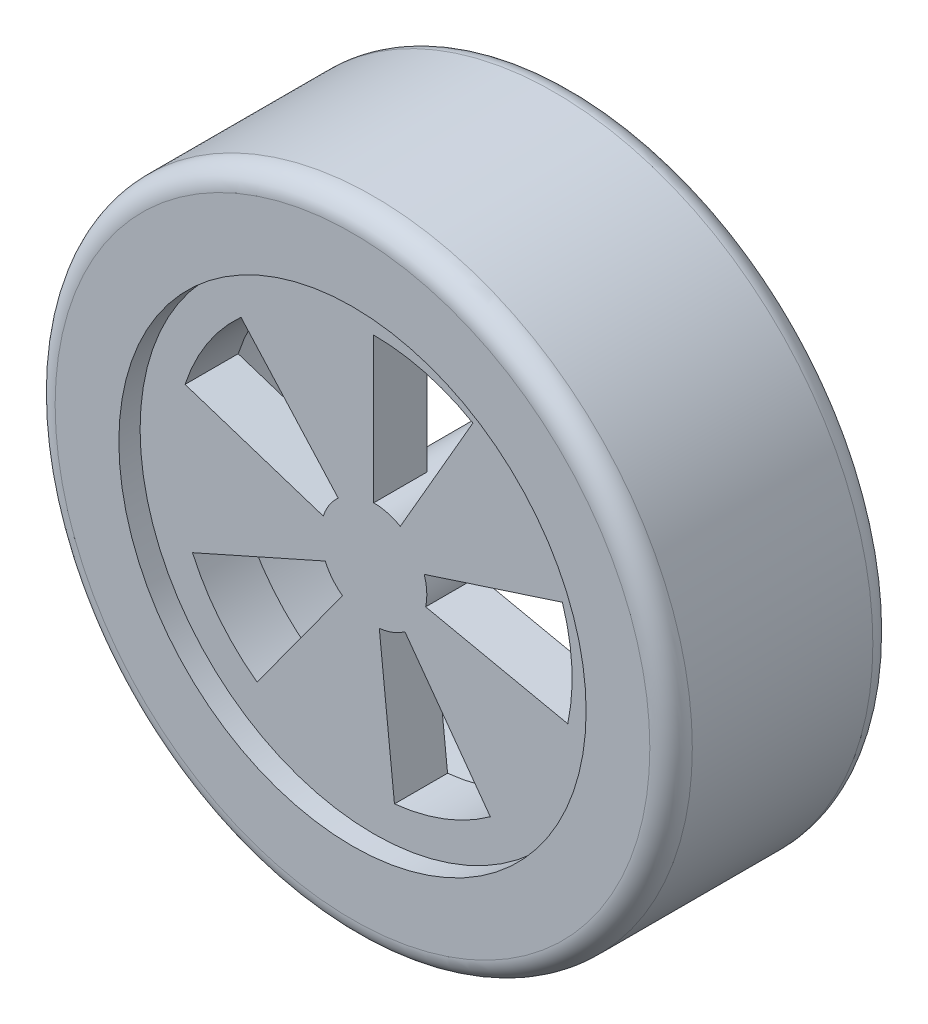
from build123d import *
from build123d.topology import SkipClean

# Parameters (mm, degrees)
SKETCH1_R           = 15
BOSS_EXTRUDE1_DEPTH = 10.5
SKETCH2_R           = 11
CUT_EXTRUDE1_DEPTH  = 1
SKETCH3_R           = 12
SKETCH3_R_2         = 2.5
SKETCH3_R_3         = 1
CUT_EXTRUDE2_DEPTH  = 7
BOSS_EXTRUDE2_START = 2.5
SKETCH3_4_R         = 2.5
SKETCH3_4_R_2       = 1
BOSS_EXTRUDE2_DEPTH = 2.5
FILLET1_R           = 1
CUT_EXTRUDE3_DEPTH  = 25.372115214


with BuildPart() as part:
    # Sketch1 → Boss-Extrude1 (new body)
    with BuildSketch(Plane.XY):
        Circle(SKETCH1_R)
    extrude(amount=BOSS_EXTRUDE1_DEPTH)

    # Sketch2 → Cut-Extrude1 (cut)
    with BuildSketch(Plane.XY.offset(10.5)):
        Circle(SKETCH2_R)
    extrude(amount=-CUT_EXTRUDE1_DEPTH, mode=Mode.SUBTRACT)

    # Sketch3 → Cut-Extrude2 (cut)
    # profile 1 of 2: a face of its own
    with BuildSketch(Plane(origin=(0, 0, 0), x_dir=(-1, 0, 0), z_dir=(0, 0, -1))):
        Circle(SKETCH3_R)
        Circle(SKETCH3_R_2, mode=Mode.SUBTRACT)
    # profile 2 of 2: a face of its own
    with BuildSketch(Plane(origin=(0, 0, 0), x_dir=(-1, 0, 0), z_dir=(0, 0, -1))):
        Circle(SKETCH3_R_3)
    extrude(amount=-CUT_EXTRUDE2_DEPTH, mode=Mode.SUBTRACT)

    # Sketch3<4> → Boss-Extrude2 (add)
    with BuildSketch(Plane(origin=(0, 0, 0), x_dir=(-1, 0, 0), z_dir=(0, 0, -1)).offset(BOSS_EXTRUDE2_START)):
        Circle(SKETCH3_4_R)
        Circle(SKETCH3_4_R_2, mode=Mode.SUBTRACT)
    extrude(amount=-BOSS_EXTRUDE2_DEPTH)

    # Fillet1
    fillet1_edges = [part.edges().sort_by_distance(p)[0] for p in [
        (-15, 0, 0),
        (-15, 0, 10.5),
    ]]
    fillet(fillet1_edges, radius=FILLET1_R)

    # Sketch4 → Cut-Extrude3 (cut, through all)
    with SkipClean():  # the faces are left unmerged after this step: merging them gives an invalid solid
        with BuildSketch(Plane.XY.offset(9.5)):
            with BuildLine():
                Line((0, 2.5), (0, 9.339610027))
                ThreePointArc((0, 9.339610027), (2.417268949, 9.021370532), (4.669805013, 8.088339545))
                Line((4.669805013, 8.088339545), (1.25, 2.165063509))
                ThreePointArc((1.25, 2.165063509), (0.647047613, 2.414814566), (0, 2.5))
            make_face()
            with BuildLine():
                Line((2.377641291, 0.772542486), (8.882496976, 2.886098219))
                ThreePointArc((8.882496976, 2.886098219), (9.326810416, 0.488797422), (9.135517139, -1.941814112))
                Line((9.135517139, -1.941814112), (2.445369002, -0.519779227))
                ThreePointArc((2.445369002, -0.519779227), (2.496573837, 0.130839891), (2.377641291, 0.772542486))
            make_face()
            with BuildLine():
                Line((1.469463131, -2.022542486), (5.489685036, -7.555903232))
                ThreePointArc((5.489685036, -7.555903232), (3.347016895, -8.719277112), (0.976255084, -9.288446666))
                Line((0.976255084, -9.288446666), (0.261321158, -2.486304738))
                ThreePointArc((0.261321158, -2.486304738), (0.895919874, -2.333951066), (1.469463131, -2.022542486))
            make_face()
            with BuildLine():
                Line((-1.469463131, -2.022542486), (-5.489685036, -7.555903232))
                ThreePointArc((-5.489685036, -7.555903232), (-7.258240214, -5.877607034), (-8.532158316, -3.79876163))
                Line((-8.532158316, -3.79876163), (-2.283863644, -1.016841608))
                ThreePointArc((-2.283863644, -1.016841608), (-1.942864904, -1.573300978), (-1.469463131, -2.022542486))
            make_face()
            with BuildLine():
                Line((-2.377641291, 0.772542486), (-8.882496976, 2.886098219))
                ThreePointArc((-8.882496976, 2.886098219), (-7.832856045, 5.086716192), (-6.24941892, 6.940682863))
                Line((-6.24941892, 6.940682863), (-1.672826516, 1.857862064))
                ThreePointArc((-1.672826516, 1.857862064), (-2.09667642, 1.361597588), (-2.377641291, 0.772542486))
            make_face()
        extrude(amount=-CUT_EXTRUDE3_DEPTH, mode=Mode.SUBTRACT)


solid = part.part
